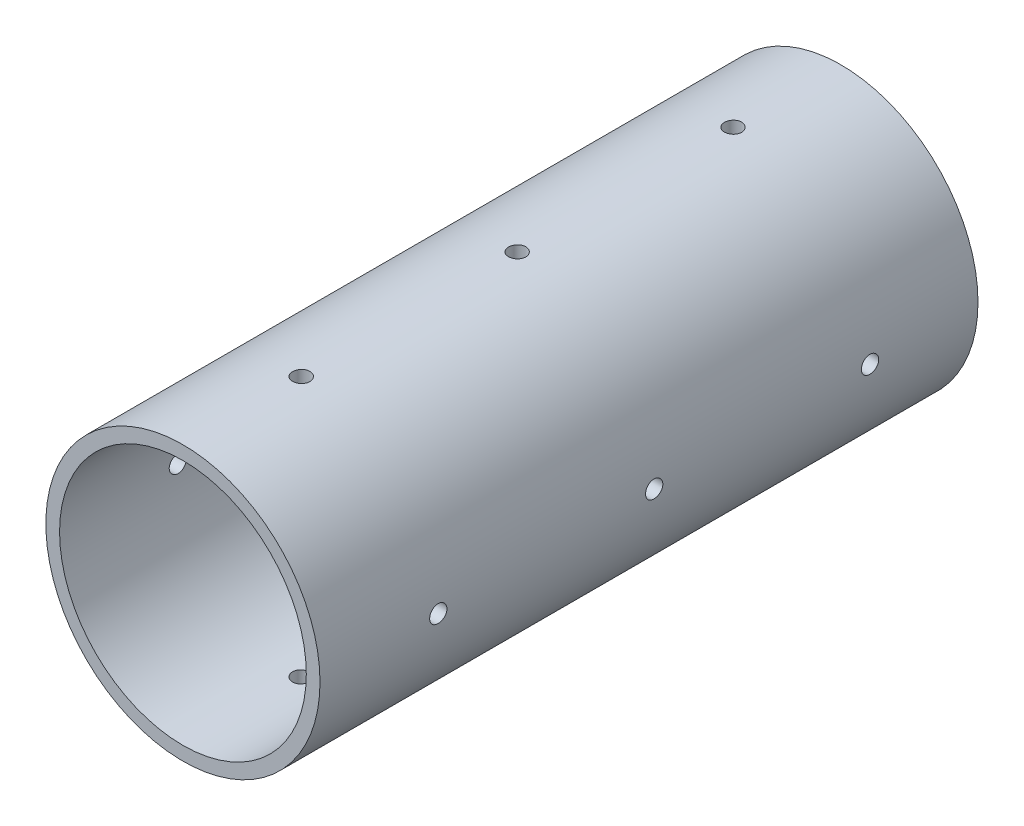
from build123d import *

# Parameters (mm, degrees)
SKETCH1_R                    = 15.875
SKETCH1_R_2                  = 14.2875
BOSS_EXTRUDE1_DEPTH          = 76.2
F_2MM_HOLE_REACH             = 81.438
SKETCH2_R                    = 1
F_2MM_HOLE_DIRECTION_2_DEPTH = 80.43847462
CIRPATTERN1_COUNT            = 4
LPATTERN1_START              = -15.8750001
LPATTERN1_OUTLINE_R          = 1
LPATTERN1_DEPTH              = 31.7500002
LPATTERN1_START_2            = -15.875000083
LPATTERN1_2_OUTLINE_R        = 1
LPATTERN1_2_DEPTH            = 31.750000166


# Read off the part's stored shape, not the designer's step: LPattern1
with BuildPart() as part:
    # Sketch1 → Boss-Extrude1 (new body)
    with BuildSketch(Plane.XY):
        with Locations(Location((0, 0, 0), (0, 0, 180))):
            Circle(SKETCH1_R)
        with Locations(Location((0, 0, 0), (0, 0, 180))):
            Circle(SKETCH1_R_2, mode=Mode.SUBTRACT)
    extrude(amount=BOSS_EXTRUDE1_DEPTH)

    # Sketch2 → 2mm Hole (cut, up to next)
    with BuildSketch(Plane(origin=(0, 0, 0), x_dir=(0, 0, -1), z_dir=(1, 0, 0)), mode=Mode.PRIVATE) as f_2mm_hole_sk1:
        with Locations(Location((-12.5, 0, 0), (0, 0, 180))):
            Circle(SKETCH2_R)
    f_2mm_hole_tool1 = extrude(f_2mm_hole_sk1.sketch, amount=-F_2MM_HOLE_REACH, mode=Mode.PRIVATE) & part.part
    f_2mm_hole = f_2mm_hole_tool1.solids().sort_by_distance((0, 0, 12.5))[0]
    add(f_2mm_hole, mode=Mode.SUBTRACT)

    # Sketch2 → 2mm Hole direction 2 (cut)
    with BuildSketch(Plane(origin=(0, 0, 0), x_dir=(0, 0, -1), z_dir=(1, 0, 0))):
        with Locations(Location((-12.5, 0, 0), (0, 0, 180))):
            Circle(SKETCH2_R)
    f_2mm_hole_direction_2 = extrude(amount=F_2MM_HOLE_DIRECTION_2_DEPTH, mode=Mode.SUBTRACT)

    # CirPattern1: 2mm Hole, 2mm Hole direction 2 ×4 about axis
    cirpattern1_axis = Axis((0, 0, 80.01), (0, 0, -1))
    add([f_2mm_hole.rotate(cirpattern1_axis, i * 360 / CIRPATTERN1_COUNT) for i in range(1, CIRPATTERN1_COUNT)], mode=Mode.SUBTRACT)
    add([f_2mm_hole_direction_2.rotate(cirpattern1_axis, i * 360 / CIRPATTERN1_COUNT) for i in range(1, CIRPATTERN1_COUNT)], mode=Mode.SUBTRACT)

    # LPattern1 outline → LPattern1 (cut)
    with BuildSketch(Plane.YZ.offset(LPATTERN1_START)):
        with Locations((0, 37.5)):
            Circle(LPATTERN1_OUTLINE_R)
        with Locations((0, 62.5)):
            Circle(LPATTERN1_OUTLINE_R)
    extrude(amount=LPATTERN1_DEPTH, mode=Mode.SUBTRACT)

    # LPattern1 2 outline → LPattern1 2 (cut)
    with BuildSketch(Plane(origin=(0, 0, 0), x_dir=(1, 0, 0), z_dir=(0, 1, 0)).offset(LPATTERN1_START_2)):
        with Locations((0, -37.5)):
            Circle(LPATTERN1_2_OUTLINE_R)
        with Locations((0, -62.5)):
            Circle(LPATTERN1_2_OUTLINE_R)
    extrude(amount=LPATTERN1_2_DEPTH, mode=Mode.SUBTRACT)


solid = part.part
